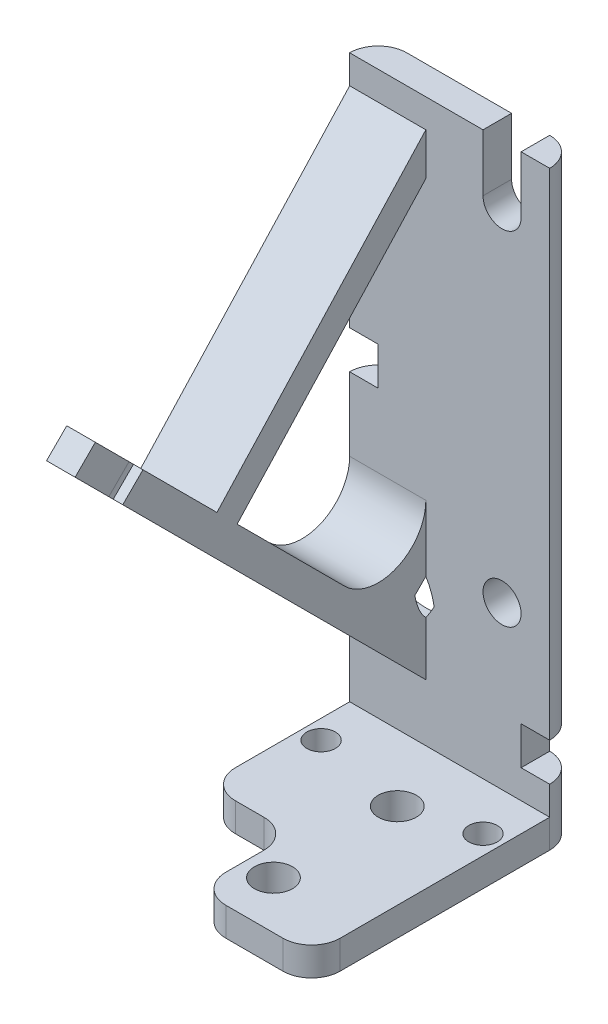
from build123d import *

# Parameters (mm, degrees)
SKETCH_1_R          = 2
SKETCH_1_R_2        = 1.5
EXTRUDE_1_DEPTH     = 3
SKETCH_3_W          = 18
SKETCH_3_H          = 3
EXTRUDE_3_DEPTH     = 56
SKETCH_4_R          = 2
CUT_EXTRUDE_1_DEPTH = 66.192024052
FILLET_1_R          = 3
EXTRUDE_4_DEPTH     = 8
SKETCH_8_R          = 2
CUT_EXTRUDE_4_DEPTH = 2
FILLET_2_R          = 3
FILLET_3_R          = 5
EXTRUDE_5_DEPTH     = 8
SKETCH_10_R         = 2
CUT_EXTRUDE_5_DEPTH = 63.070878351
SKETCH_11_R         = 4
CUT_EXTRUDE_6_DEPTH = 15
CUT_EXTRUDE_7_REACH = 67.077
SKETCH_13_W         = 9
SKETCH_13_H         = 10
FILLET_4_R          = 3
SKETCH_14_W         = 4
SKETCH_14_H         = 4.648660845
CUT_EXTRUDE_8_DEPTH = 68.134194076
CHAMFER_1_SIZE      = 2
SKETCH_15_W         = 1
SKETCH_15_H         = 3
SKETCH_15_W_2       = 3
EXTRUDE_6_DEPTH     = 3
EXTRUDE_7_DEPTH     = 3
SKETCH_18_W         = 3
SKETCH_18_H         = 4
CUT_EXTRUDE_9_DEPTH = 3


# Some blends are built 0.0001 mm under size
with BuildPart() as part:
    # 草图1 → 凸台-拉伸1 (new body)
    with BuildSketch(Plane(origin=(0, 0, 0), x_dir=(1, 0, 0), z_dir=(0, 1, 0))):
        Polygon((-12, 0), (-12, 8), (9, 8), (9, -20), (0, -20), (-12, -20), align=None)
        with Locations(Location((0, -15, 0), (0, 0, 270))):
            Circle(SKETCH_1_R, mode=Mode.SUBTRACT)
        with Locations(Location((-10, 0, 0), (0, 0, 270))):
            Circle(SKETCH_1_R_2, mode=Mode.SUBTRACT)
        with Locations(Location((0, -2, 0), (0, 0, 270))):
            Circle(SKETCH_1_R, mode=Mode.SUBTRACT)
        with Locations(Location((7, 0, 0), (0, 0, 90))):
            Circle(SKETCH_1_R_2, mode=Mode.SUBTRACT)
    extrude(amount=EXTRUDE_1_DEPTH)

    # 草图3 → 凸台-拉伸3 (add)
    with BuildSketch(Plane(origin=(0, 3, 0), x_dir=(1, 0, 0), z_dir=(0, 1, 0))):
        with Locations((0, 6.5)):
            Rectangle(SKETCH_3_W, SKETCH_3_H)
    extrude(amount=EXTRUDE_3_DEPTH)

    # 草图4 → 切除-拉伸1 (cut, through all)
    with BuildSketch(Plane.XY.offset(-5)):
        with Locations((4, 56)):
            Circle(SKETCH_4_R)
        with Locations((4, 20)):
            Circle(SKETCH_4_R)
    extrude(amount=-CUT_EXTRUDE_1_DEPTH, mode=Mode.SUBTRACT)

    # 圆角1
    fillet_1_edges = [part.edges().sort_by_distance(p)[0] for p in [
        (-12, 1.5, -8),
        (-12, 1.5, 20),
        (9, 1.5, 20),
        (9, 29.5, -8),
    ]]
    fillet(fillet_1_edges, radius=FILLET_1_R - 0.0001)  # a hair under: the kernel refuses the full size

    # 草图5 → 凸台-拉伸4 (add)
    with BuildSketch(Plane.ZY.offset(12)):
        Polygon((-5, 13.242640687), (22.577164466, 40.819805153), (24.69848481, 38.69848481), (-5, 9), (-5, 3), (-8, 3), (-8, 59), (-5, 59), align=None)
    extrude(amount=-EXTRUDE_4_DEPTH)

    # 草图8 → 切除-拉伸4 (cut)
    with BuildSketch(Plane(origin=(0, 7, -7), x_dir=(1, 0, 0), z_dir=(0, -0.7071067811865512, 0.7071067811865438))):
        with Locations(Location((-7, 6.828427125, 0), (0, 0, 270))):
            Circle(SKETCH_8_R)
        with BuildLine():
            Line((-5, 42.828427125), (-5, 44.828427125))
            Line((-5, 44.828427125), (-9, 44.828427125))
            Line((-9, 44.828427125), (-9, 42.828427125))
            ThreePointArc((-9, 42.828427125), (-7, 40.828427125), (-5, 42.828427125))
        make_face()
    extrude(amount=-CUT_EXTRUDE_4_DEPTH, mode=Mode.SUBTRACT)

    # 圆角2
    fillet_2_edges = [part.edges().sort_by_distance(p)[0] for p in [
        (-12, 31, -8),
    ]]
    fillet(fillet_2_edges, radius=FILLET_2_R - 0.0001)  # a hair under: the kernel refuses the full size

    # 圆角3
    fillet_3_edges = [part.edges().sort_by_distance(p)[0] for p in [
        (-8, 13.242640687, -5),
    ]]
    fillet(fillet_3_edges, radius=FILLET_3_R)

    # 草图9 → 凸台-拉伸5 (add)
    with BuildSketch(Plane.ZY.offset(12)):
        Polygon((14.8101253, 33.052765987), (17.233592146, 34.849668975), (-5, 59), (-5, 54.570705171), align=None)
    extrude(amount=-EXTRUDE_5_DEPTH)

    # 草图10 → 切除-拉伸5 (cut, through all)
    with BuildSketch(Plane(origin=(0, 7, -7), x_dir=(1, 0, 0), z_dir=(0, -0.7071067811865509, 0.7071067811865441))):
        with Locations(Location((-7, 6.828427125, 0), (0, 0, 270))):
            Circle(SKETCH_10_R)
        with BuildLine():
            Line((-5, 42.828427125), (-5, 44.828427125))
            Line((-5, 44.828427125), (-9, 44.828427125))
            Line((-9, 44.828427125), (-9, 42.828427125))
            ThreePointArc((-9, 42.828427125), (-7, 40.828427125), (-5, 42.828427125))
        make_face()
    extrude(amount=-CUT_EXTRUDE_5_DEPTH, mode=Mode.SUBTRACT)

    # 草图11 → 切除-拉伸6 (cut)
    with BuildSketch(Plane(origin=(0, 21.142135624, -21.142135624), x_dir=(-1, 0, 0), z_dir=(0, -0.7071067811865509, 0.7071067811865441))):
        with Locations((7, -6.828427125)):
            Circle(SKETCH_11_R)
    extrude(amount=CUT_EXTRUDE_6_DEPTH, mode=Mode.SUBTRACT)

    # 草图13 → 切除-拉伸7 (cut, up to next)
    with BuildSketch(Plane.XZ, mode=Mode.PRIVATE) as cut_extrude_7_sk1:
        with Locations((-7.5, 15)):
            Rectangle(SKETCH_13_W, SKETCH_13_H)
    cut_extrude_7_tool1 = extrude(cut_extrude_7_sk1.sketch, amount=-CUT_EXTRUDE_7_REACH, mode=Mode.PRIVATE) & part.part
    add(cut_extrude_7_tool1.solids().sort_by_distance((-7.5, 0, 15))[0], mode=Mode.SUBTRACT)

    # 圆角4
    fillet_4_edges = [part.edges().sort_by_distance(p)[0] for p in [
        (-3, 1.5, 10),
        (-3, 1.5, 20),
        (-12, 1.5, 10),
    ]]
    fillet(fillet_4_edges, radius=FILLET_4_R)

    # 草图14 → 切除-拉伸8 (cut, through all)
    with BuildSketch(Plane.XY.offset(-5)):
        with Locations((4, 58.324330422)):
            Rectangle(SKETCH_14_W, SKETCH_14_H)
    extrude(amount=-CUT_EXTRUDE_8_DEPTH, mode=Mode.SUBTRACT)

    # 倒角1
    # the kernel refuses this chamfer: 2 mm, written as the material it takes off along each edge
    with BuildSketch(Plane(origin=(-7, 15.363961031, -5.707106781), x_dir=(0, -0.7071067811865436, -0.7071067811865516), z_dir=(-1, 0, 0))) as chamfer_1_piece_1:
        Polygon((2 + CHAMFER_1_SIZE, 0), (2, CHAMFER_1_SIZE), (2, 0), align=None)
    revolve(axis=Axis((-7, 15.363961031, -5.707106781), (0, -0.7071067811865512, 0.7071067811865438)), mode=Mode.SUBTRACT)

    # 草图15 → 凸台-拉伸6 (add)
    with BuildSketch(Plane(origin=(0, 31.69848481, 31.69848481), x_dir=(1, 0, 0), z_dir=(0, 0.707106781186543, 0.7071067811865521))):
        with Locations((-4.5, 11.399494937)):
            Rectangle(SKETCH_15_W, SKETCH_15_H)
        with Locations((-10.5, 11.399494937)):
            Rectangle(SKETCH_15_W_2, SKETCH_15_H)
    extrude(amount=EXTRUDE_6_DEPTH)

    # 草图16 → 凸台-拉伸7 (add)
    with BuildSketch(Plane(origin=(0, 59, 0), x_dir=(1, 0, 0), z_dir=(0, 1, 0))):
        with BuildLine():
            Line((-4, 5), (2, 5))
            Line((2, 5), (2, 8))
            Line((2, 8), (-9, 8))
            ThreePointArc((-9, 8), (-11.121320344, 7.121320344), (-12, 5))
            Line((-12, 5), (-4, 5))
        make_face()
        with BuildLine():
            Line((6, 8), (6, 5))
            Line((6, 5), (9, 5))
            ThreePointArc((9, 5), (8.121320344, 7.121320344), (6, 8))
        make_face()
    extrude(amount=EXTRUDE_7_DEPTH)

    # 草图18 → 切除-拉伸9 (cut)
    with BuildSketch(Plane(origin=(0, 0, -8), x_dir=(-1, 0, 0), z_dir=(0, 0, -1))):
        with Locations((10.5, 35)):
            Rectangle(SKETCH_18_W, SKETCH_18_H)
        with Locations((-7.5, 8)):
            Rectangle(SKETCH_18_W, SKETCH_18_H)
    extrude(amount=-CUT_EXTRUDE_9_DEPTH, mode=Mode.SUBTRACT)


solid = part.part
